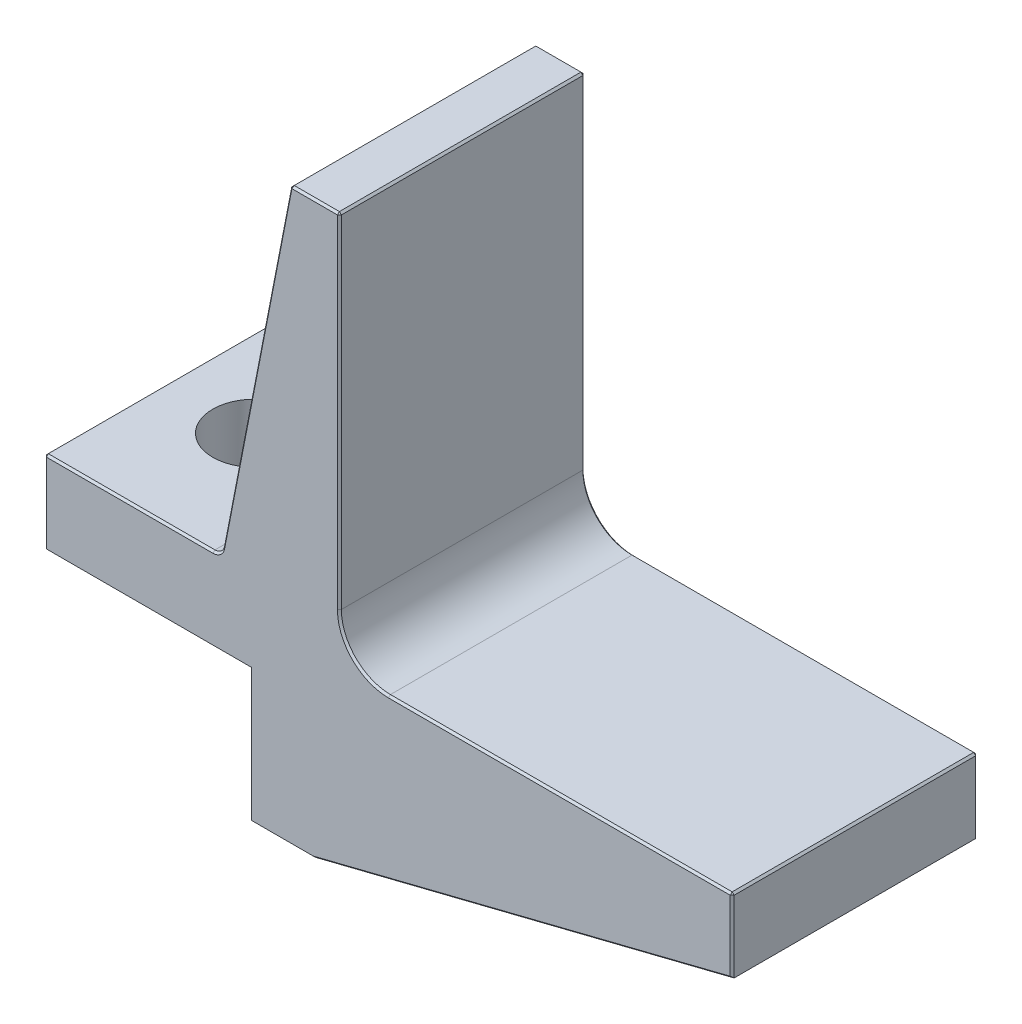
from build123d import *
from OCP.BRepFilletAPI import BRepFilletAPI_MakeChamfer

# Parameters (mm, degrees)
BOSS_EXTRUDE1_DEPTH          = 31.75
F_3_8_0_375_DIAMETER_HOLE1_D = 10.795
FILLET1_R                    = 1.27
FILLET2_R                    = 6.35
CHAMFER1_SIZE                = 0.254
CHAMFER1_SIZE2               = 0.321383695


with BuildPart() as part:
    # Sketch1 → Boss-Extrude1 (new body)
    with BuildSketch(Plane.XY):
        Polygon((0, 0), (50.8, 0), (50.8, -9.525), (-3.3628076, -23.086314), (-11.6178076, -23.086314), (-11.6178076, -5.941314), (-38.1608076, -5.941314), (-38.1608076, 4.853686), (-15.3008076, 4.853686), (-6.35, 50.8), (0, 50.8), align=None)
    extrude(amount=BOSS_EXTRUDE1_DEPTH)

    # 3/8 (0.375) Diameter Hole1 (through all)
    with Locations(Plane(origin=(0, 4.853686, 0), x_dir=(1, 0, 0), z_dir=(0, 1, 0))):
        with Locations((-26.8578076, -15.875)):
            Hole(F_3_8_0_375_DIAMETER_HOLE1_D / 2)

    # Fillet1
    fillet1_edges = [part.edges().sort_by_distance(p)[0] for p in [
        (-15.3008076, 4.853686, 15.875),
    ]]
    fillet(fillet1_edges, radius=FILLET1_R)

    # Fillet2
    fillet2_edges = [part.edges().sort_by_distance(p)[0] for p in [
        (0, 0, 15.875),
    ]]
    fillet(fillet2_edges, radius=FILLET2_R)

    # Chamfer1: one chamfer whose edges measure the first distance from different faces: ONE call of the kernel's chamfer builder (chamfer() names one face for all edges)
    chamfer1_edges_1 = [part.edges().sort_by_distance(p)[0] for p in [
        (-6.35, 50.8, 15.875),
    ]]
    chamfer1_side_1 = [part.faces().sort_by_distance(p)[0] for p in [
        (-3.175, 50.8, 15.875),
    ]]
    chamfer1_edges_2 = [part.edges().sort_by_distance(p)[0] for p in [
        (-3.175, 50.8, 0),
        (-3.175, 50.8, 31.75),
        (0, 50.8, 15.875),
        (-10.725353572, 28.340421149, 0),
        (-10.725353572, 28.340421149, 31.75),
        (-15.539656801, 5.143555524, 0),
        (-15.539656801, 5.143555524, 31.75),
        (-27.254040401, 4.853686, 0),
        (-38.1608076, 4.853686, 15.875),
        (-27.254040401, 4.853686, 31.75),
        (-38.1608076, -0.543814, 0),
        (-38.1608076, -5.941314, 15.875),
        (-38.1608076, -0.543814, 31.75),
        (-24.8893076, -5.941314, 0),
        (-24.8893076, -5.941314, 31.75),
        (50.8, -4.7625, 0),
        (50.8, -4.7625, 31.75),
        (50.8, 0, 15.875),
        (28.575, 0, 0),
        (1.859871939, 1.859871939, 0),
        (1.859871939, 1.859871939, 31.75),
        (0, 28.575, 0),
        (0, 28.575, 31.75),
        (28.575, 0, 31.75),
        (-11.6178076, -14.513814, 0),
        (-11.6178076, -14.513814, 31.75),
        (-7.4903076, -23.086314, 0),
        (-7.4903076, -23.086314, 31.75),
        (23.7185962, -16.305657, 0),
        (23.7185962, -16.305657, 31.75),
    ]]
    chamfer1 = BRepFilletAPI_MakeChamfer(part.part.solid().wrapped)
    for e in chamfer1_edges_1:
        chamfer1.Add(CHAMFER1_SIZE, CHAMFER1_SIZE2, e.wrapped, chamfer1_side_1[0].wrapped)  # the first distance lies on this face
    for e in chamfer1_edges_2:
        chamfer1.Add(CHAMFER1_SIZE, e.wrapped)
    add(Compound.cast(chamfer1.Shape()), mode=Mode.REPLACE)


solid = part.part
